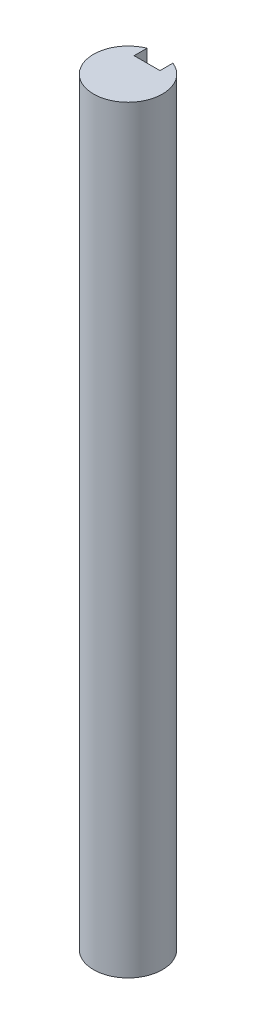
from build123d import *

# Parameters (mm, degrees)
BOSS_EXTRUDE1_DEPTH = 69.85


with BuildPart() as part:
    # Sketch1 → Boss-Extrude1 (new body)
    with BuildSketch(Plane(origin=(0, 0, 0), x_dir=(1, 0, 0), z_dir=(0, 1, 0))):
        with BuildLine():
            Line((-1.190625, 2.943303775), (-1.190625, 1.752678775))
            Line((-1.190625, 1.752678775), (1.190625, 1.752678775))
            Line((1.190625, 1.752678775), (1.190625, 2.943303775))
            ThreePointArc((1.190625, 2.943303775), (0, -3.175), (-1.190625, 2.943303775))
        make_face()
    extrude(amount=BOSS_EXTRUDE1_DEPTH)


solid = part.part
